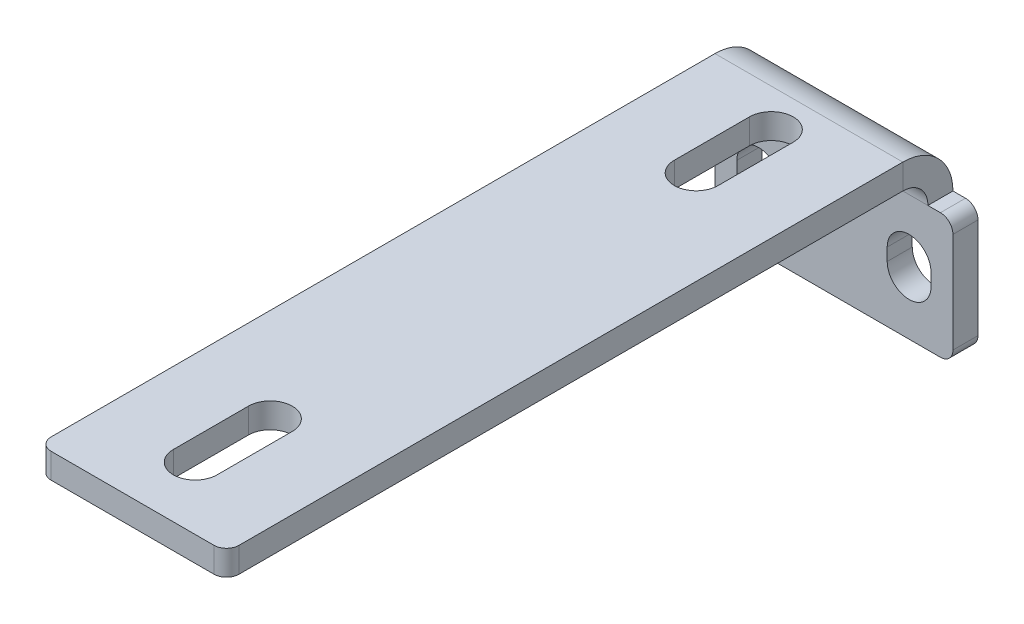
from build123d import *

# Parameters (mm, degrees)
CROQUIS1_W             = 19
CROQUIS1_H             = 10
BRIDA_BASE1_DEPTH      = 2
BRIDA_DE_ARISTA1_DEPTH = 15
CORTAR_EXTRUIR1_REACH  = 62.77
REDONDEO1_R            = 1


# Sheet-metal steps are written as plain solids
with BuildPart() as part:
    # Croquis1 → Brida base1 (new body)
    with BuildSketch(Plane.XY):
        with Locations((9.5, -5)):
            Rectangle(CROQUIS1_W, CROQUIS1_H)
        with BuildLine():
            Line((5.25, -4.5), (5.25, -5.5))
            ThreePointArc((5.25, -5.5), (3.5, -7.25), (1.75, -5.5))
            Line((1.75, -5.5), (1.75, -4.5))
            ThreePointArc((1.75, -4.5), (3.5, -2.75), (5.25, -4.5))
        make_face(mode=Mode.SUBTRACT)
        with BuildLine():
            Line((17.25, -4.5), (17.25, -5.5))
            ThreePointArc((17.25, -5.5), (15.5, -7.25), (13.75, -5.5))
            Line((13.75, -5.5), (13.75, -4.5))
            ThreePointArc((13.75, -4.5), (15.5, -2.75), (17.25, -4.5))
        make_face(mode=Mode.SUBTRACT)
    extrude(amount=-BRIDA_BASE1_DEPTH)

    # Brida de arista1 section (across the edge) → Brida de arista1 (add)
    with BuildSketch(Plane(origin=(17, 2, 0), x_dir=(0, -1, 0), z_dir=(-1, 0, 0))):
        with BuildLine():
            Line((-2, 2), (-2, 56))
            Line((-2, 56), (0, 56))
            Line((0, 56), (0, 2))
            ThreePointArc((0, 2), (0.585786438, 0.585786438), (2, 0))
            Line((2, 0), (2, -2))
            ThreePointArc((2, -2), (-0.828427125, -0.828427125), (-2, 2))
        make_face()
    extrude(amount=BRIDA_DE_ARISTA1_DEPTH)

    # Croquis9 → Cortar-Extruir1 (cut, up to next)
    with BuildSketch(Plane(origin=(0, 4, 0), x_dir=(1, 0, 0), z_dir=(0, 1, 0)), mode=Mode.PRIVATE) as cortar_extruir1_sk1:
        with BuildLine():
            Line((7.75, -11), (7.75, -5))
            ThreePointArc((7.75, -5), (9.5, -3.25), (11.25, -5))
            Line((11.25, -5), (11.25, -11))
            ThreePointArc((11.25, -11), (9.5, -12.75), (7.75, -11))
        make_face()
    cortar_extruir1_tool1 = extrude(cortar_extruir1_sk1.sketch, amount=-CORTAR_EXTRUIR1_REACH, mode=Mode.PRIVATE) & part.part
    # Croquis9 → Cortar-Extruir1 (cut, up to next)
    with BuildSketch(Plane(origin=(0, 4, 0), x_dir=(1, 0, 0), z_dir=(0, 1, 0)), mode=Mode.PRIVATE) as cortar_extruir1_sk2:
        with BuildLine():
            Line((7.75, -51), (7.75, -45))
            ThreePointArc((7.75, -45), (9.5, -43.25), (11.25, -45))
            Line((11.25, -45), (11.25, -51))
            ThreePointArc((11.25, -51), (9.5, -52.75), (7.75, -51))
        make_face()
    cortar_extruir1_tool2 = extrude(cortar_extruir1_sk2.sketch, amount=-CORTAR_EXTRUIR1_REACH, mode=Mode.PRIVATE) & part.part
    add(cortar_extruir1_tool1.solids().sort_by_distance((9.5, 4, 8))[0], mode=Mode.SUBTRACT)
    add(cortar_extruir1_tool2.solids().sort_by_distance((9.5, 4, 48))[0], mode=Mode.SUBTRACT)

    # Redondeo1
    redondeo1_edges = [part.edges().sort_by_distance(p)[0] for p in [
        (17, 3, 56),
        (2, 3, 56),
        (0, 0, -1),
        (19, 0, -1),
        (19, -10, -1),
        (0, -10, -1),
    ]]
    fillet(redondeo1_edges, radius=REDONDEO1_R)


solid = part.part
